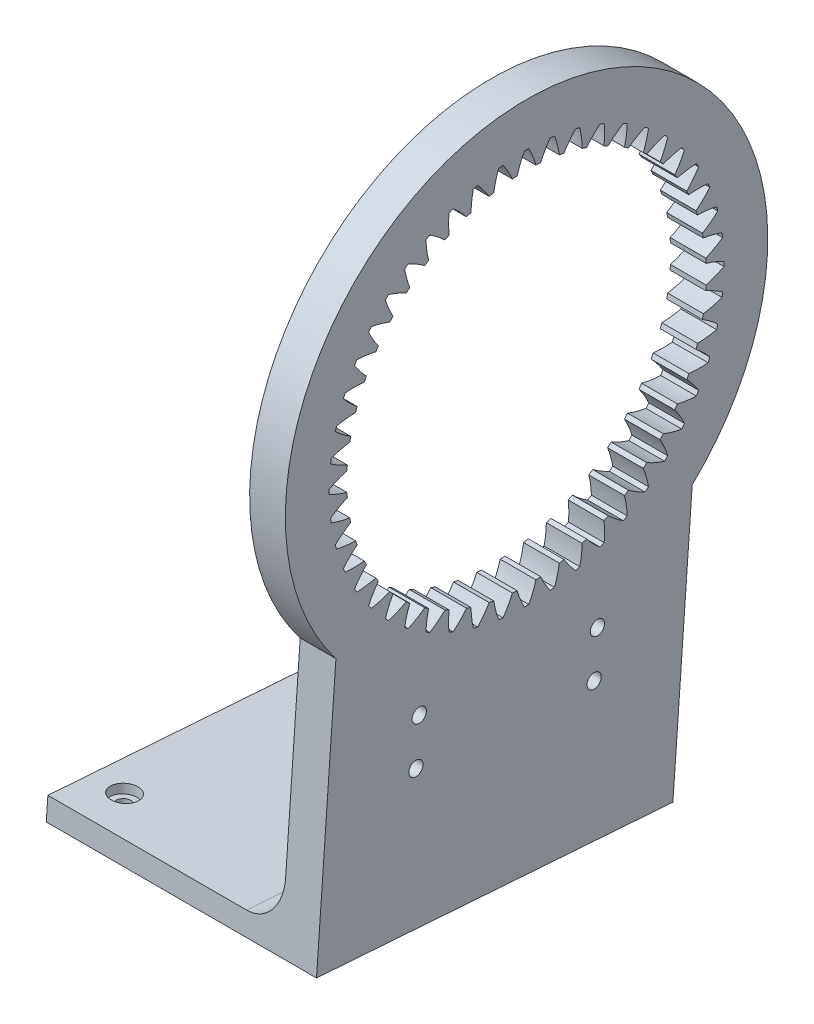
from build123d import *

# Parameters (mm, degrees)
BASPROSKE_W                  = 8
BASPROSKE_H                  = 13.75
TOOTHCUT_DEPTH               = 77.785415282
TEETHCUTS_COUNT              = 48
ESQUISSE1_R                  = 1.6
ENL_V_MAT_EXTRU_1_DEPTH      = 10
R_P_TITION_CIRCULAIRE1_COUNT = 6
BOSS_EXTRU_1_DEPTH           = 8
ESQUISSE3_R                  = 2.47870488
BOSS_EXTRU_2_DEPTH           = 8
R_P_TITION_CIRCULAIRE3_COUNT = 6
ESQUISSE4_R                  = 1.6
ENL_V_MAT_EXTRU_2_DEPTH      = 10
BOSS_EXTRU_3_START           = -8
BOSS_EXTRU_3_DEPTH           = 52.5
CONG_1_SIZE                  = 10
CONG_1_SIZE_2                = 8
ESQUISSE6_R                  = 3
ENL_V_MAT_EXTRU_3_DEPTH      = 2
ESQUISSE7_R                  = 1.6
ENL_V_MAT_EXTRU_4_DEPTH      = 5
R_P_TITION_CIRCULAIRE4_COUNT = 6


with BuildPart() as part:
    # BasProSke → Base-Revolve (revolve)
    with BuildSketch(Plane(origin=(0, 0, 0), x_dir=(1, 0, 0), z_dir=(0, 1, 0)), mode=Mode.PRIVATE) as base_revolve_sk:
        with Locations((4, 47.125)):
            Rectangle(BASPROSKE_W, BASPROSKE_H)
    revolve(base_revolve_sk.sketch.rotate(Axis((-10, 0, 0), (1, 0, 0)), 180), axis=Axis((-10, 0, 0), (1, 0, 0)))

    # TooCutSke → ToothCut (cut, through all)
    with BuildSketch(Plane(origin=(0, 0, 0), x_dir=(0, 0, -1), z_dir=(1, 0, 0))):
        with BuildLine():
            ThreePointArc((2.110563708, 40.169191752), (1.409972129, 42.218958462), (0.501952026, 44.185648987))
            ThreePointArc((0.501952026, 44.185648987), (0, 44.1885), (-0.501952026, 44.185648987))
            ThreePointArc((-0.501952026, 44.185648987), (-1.409972129, 42.218958462), (-2.110563708, 40.169191752))
            ThreePointArc((-2.110563708, 40.169191752), (0, 40.2246), (2.110563708, 40.169191752))
        make_face()
    toothcut = extrude(amount=TOOTHCUT_DEPTH, mode=Mode.SUBTRACT)

    # TeethCuts: ToothCut ×48 about axis
    teethcuts_axis = Axis((0, 0, 0), (1, 0, 0))
    for i in range(1, TEETHCUTS_COUNT):
        add(toothcut.rotate(teethcuts_axis, i * 360 / TEETHCUTS_COUNT), mode=Mode.SUBTRACT)

    # Esquisse1 → Enlèv. mat.-Extru.1 (cut)
    with BuildSketch(Plane(origin=(8, 0, 0), x_dir=(0, 0, -1), z_dir=(1, 0, 0))):
        with Locations((3.532945449, 48.560151654)):
            Circle(ESQUISSE1_R)
    enl_v_mat_extru_1 = extrude(amount=-ENL_V_MAT_EXTRU_1_DEPTH, mode=Mode.SUBTRACT)

    # Répétition circulaire1: Enlèv. mat.-Extru.1 ×6 about axis
    r_p_tition_circulaire1_axis = Axis((0, 0, 0), (1, 0, 0))
    for i in range(1, R_P_TITION_CIRCULAIRE1_COUNT):
        add(enl_v_mat_extru_1.rotate(r_p_tition_circulaire1_axis, i * 360 / R_P_TITION_CIRCULAIRE1_COUNT), mode=Mode.SUBTRACT)

    # Esquisse2 → Boss.-Extru.1 (add, through all)
    with BuildSketch(Plane(origin=(8, 0, 0), x_dir=(0, 0, -1), z_dir=(1, 0, 0))):
        with BuildLine():
            ThreePointArc((37.084015632, -39.252716907), (-4.163996104, -53.8392156), (-42.67861512, -33.083769607))
            Line((-42.67861512, -33.083769607), (-47.025569896, -92.832437158))
            Line((-47.025569896, -92.832437158), (32.763541134, -98.63741443))
            Line((32.763541134, -98.63741443), (37.084015632, -39.252716907))
        make_face()
    extrude(amount=-BOSS_EXTRU_1_DEPTH)

    # Esquisse3 → Boss.-Extru.2 (add)
    with BuildSketch(Plane(origin=(8, 0, 0), x_dir=(0, 0, -1), z_dir=(1, 0, 0))):
        with Locations((-3.532945449, -48.560151654)):
            Circle(ESQUISSE3_R)
    boss_extru_2 = extrude(amount=-BOSS_EXTRU_2_DEPTH)

    # Répétition circulaire3: Boss.-Extru.2 ×6 about axis
    r_p_tition_circulaire3_axis = Axis((8, 0, 0), (-1, 0, 0))
    for i in range(1, R_P_TITION_CIRCULAIRE3_COUNT):
        add(boss_extru_2.rotate(r_p_tition_circulaire3_axis, i * 360 / R_P_TITION_CIRCULAIRE3_COUNT))

    # Esquisse4 → Enlèv. mat.-Extru.2 (cut)
    with BuildSketch(Plane.ZY):
        with Locations((-15.859275657, -56.333678875)):
            Circle(ESQUISSE4_R)
        with Locations((-15.116462763, -66.306052164)):
            Circle(ESQUISSE4_R)
        with Locations((24.773030391, -63.334800586)):
            Circle(ESQUISSE4_R)
        with Locations((24.030217496, -53.362427297)):
            Circle(ESQUISSE4_R)
    extrude(amount=-ENL_V_MAT_EXTRU_2_DEPTH, mode=Mode.SUBTRACT)

    # Esquisse5 → Boss.-Extru.3 (add)
    with BuildSketch(Plane(origin=(8, 0, 0), x_dir=(0, 0, -1), z_dir=(1, 0, 0)).offset(BOSS_EXTRU_3_START)):
        Polygon((-47.025569896, -92.832437158), (32.763541134, -98.63741443), (33.126352213, -93.650594991), (-46.662758816, -87.845617719), align=None)
    extrude(amount=-BOSS_EXTRU_3_DEPTH)

    # Congé1
    # an asymmetric fillet: 10, 8 mm, written as the material it adds along each edge
    with BuildSketch(Plane(origin=(0, -93.650594991, -33.126352213), x_dir=(0, 0.997363887867807, -0.07256221590616325), z_dir=(0, 0.07256221590616325, 0.997363887867807))) as cong_1_piece_1:
        with BuildLine():
            Bezier((CONG_1_SIZE, 0), (0, 0), (0, CONG_1_SIZE_2), weights=[1, 0.707106781, 1])
            Line((0, CONG_1_SIZE_2), (0, 0))
            Line((0, 0), (CONG_1_SIZE, 0))
        make_face()
    extrude(amount=80)

    # Esquisse6 → Enlèv. mat.-Extru.3 (cut)
    with BuildSketch(Plane(origin=(0, -90.760113796, 6.603161647), x_dir=(1, 0, 0), z_dir=(0, 0.9973638878678069, -0.07256221590616323))):
        with Locations(Location((-27.5, -0.165477872, 0), (0, 0, 270))):
            Circle(ESQUISSE6_R)
    enl_v_mat_extru_3 = extrude(amount=-ENL_V_MAT_EXTRU_3_DEPTH, mode=Mode.SUBTRACT)

    # Esquisse7 → Enlèv. mat.-Extru.4 (cut)
    with BuildSketch(Plane(origin=(0, -90.760113796, 6.603161647), x_dir=(1, 0, 0), z_dir=(0, 0.9973638878678069, -0.07256221590616323))):
        with Locations(Location((-27.5, -0.165477872, 0), (0, 0, 270))):
            Circle(ESQUISSE7_R)
    enl_v_mat_extru_4 = extrude(amount=-ENL_V_MAT_EXTRU_4_DEPTH, mode=Mode.SUBTRACT)

    # Répétition circulaire4: Enlèv. mat.-Extru.3, Enlèv. mat.-Extru.4 ×6 about axis
    r_p_tition_circulaire4_axis = Axis((-62.5, 0.012007441, 0.165041654), (0, 0.9973638878678069, -0.07256221590616324))
    add([enl_v_mat_extru_3.rotate(r_p_tition_circulaire4_axis, i * 360 / R_P_TITION_CIRCULAIRE4_COUNT) for i in range(1, R_P_TITION_CIRCULAIRE4_COUNT)], mode=Mode.SUBTRACT)
    add([enl_v_mat_extru_4.rotate(r_p_tition_circulaire4_axis, i * 360 / R_P_TITION_CIRCULAIRE4_COUNT) for i in range(1, R_P_TITION_CIRCULAIRE4_COUNT)], mode=Mode.SUBTRACT)


solid = part.part
